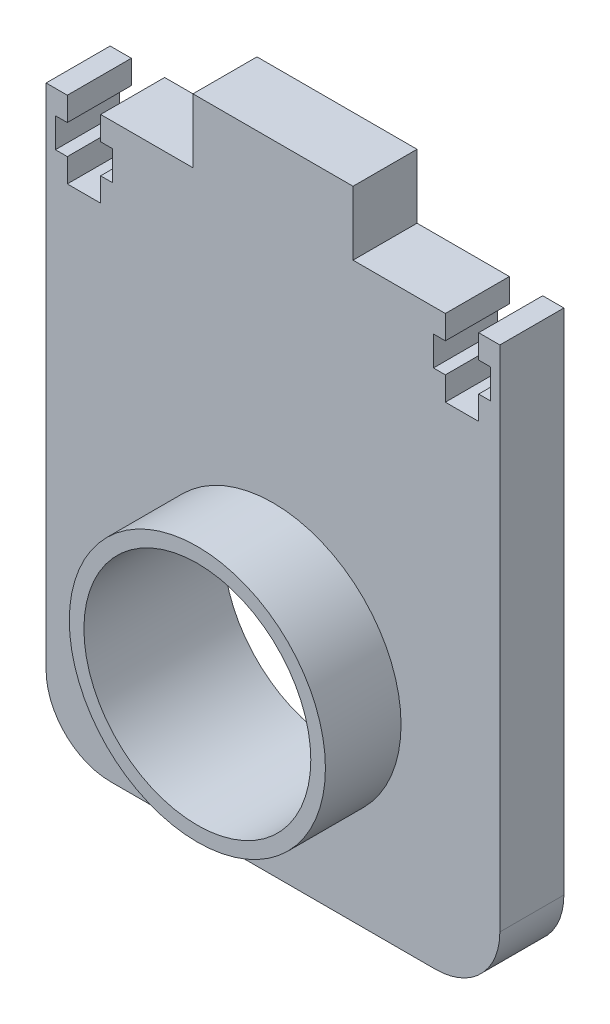
from build123d import *

# Parameters (mm, degrees)
SKETCH12_W           = 90
SKETCH12_H           = 126.33
BOSS_EXTRUDE10_DEPTH = 12.7
SKETCH15_R           = 25.4
BOSS_EXTRUDE11_DEPTH = 15
SKETCH23_R           = 22.5
CUT_EXTRUDE7_DEPTH   = 200.671813095
FILLET2_R            = 12.8
SKETCH25_W           = 29.125
SKETCH25_H           = 12.7
CUT_EXTRUDE9_DEPTH   = 199.309210439
CUT_EXTRUDE10_DEPTH  = 199.309210439


with BuildPart() as part:
    # Sketch12 → Boss-Extrude10 (new body)
    with BuildSketch(Plane.XY):
        with Locations((107.125849364, 63.165)):
            Rectangle(SKETCH12_W, SKETCH12_H)
    extrude(amount=BOSS_EXTRUDE10_DEPTH)

    # Sketch15 → Boss-Extrude11 (add)
    with BuildSketch(Plane.XY.offset(12.7)):
        with Locations((107.125849364, 38.627603634)):
            Circle(SKETCH15_R)
    extrude(amount=BOSS_EXTRUDE11_DEPTH)

    # Sketch23 → Cut-Extrude7 (cut, through all)
    with BuildSketch(Plane.XY.offset(27.7)):
        with Locations((107.125849364, 38.627603634)):
            Circle(SKETCH23_R)
    extrude(amount=-CUT_EXTRUDE7_DEPTH, mode=Mode.SUBTRACT)

    # Fillet2
    fillet2_edges = [part.edges().sort_by_distance(p)[0] for p in [
        (152.125849364, 0, 6.35),
        (62.125849364, 0, 6.35),
    ]]
    fillet(fillet2_edges, radius=FILLET2_R)

    # Sketch25 → Cut-Extrude9 (cut, through all)
    with BuildSketch(Plane.XY.offset(12.7)):
        with Locations((137.563349364, 119.98)):
            Rectangle(SKETCH25_W, SKETCH25_H)
        with Locations((76.688349364, 119.98)):
            Rectangle(SKETCH25_W, SKETCH25_H)
    extrude(amount=-CUT_EXTRUDE9_DEPTH, mode=Mode.SUBTRACT)

    # Sketch27 → Cut-Extrude10 (cut, through all)
    with BuildSketch(Plane.XY.offset(12.7)):
        Polygon((147.917849364, 113.63), (147.917849364, 108.931), (150.279849364, 108.931), (150.279849364, 103.089), (147.917849364, 103.089), (147.917849364, 98.39), (141.313849364, 98.39), (141.313849364, 103.089), (138.951849364, 103.089), (138.951849364, 108.931), (141.313849364, 108.931), (141.313849364, 113.63), align=None)
        Polygon((72.937849364, 103.089), (75.299849364, 103.089), (75.299849364, 108.931), (72.937849364, 108.931), (72.937849364, 113.63), (66.333849364, 113.63), (66.333849364, 108.931), (63.971849364, 108.931), (63.971849364, 103.089), (66.333849364, 103.089), (66.333849364, 98.39), (72.937849364, 98.39), align=None)
    extrude(amount=-CUT_EXTRUDE10_DEPTH, mode=Mode.SUBTRACT)


solid = part.part
